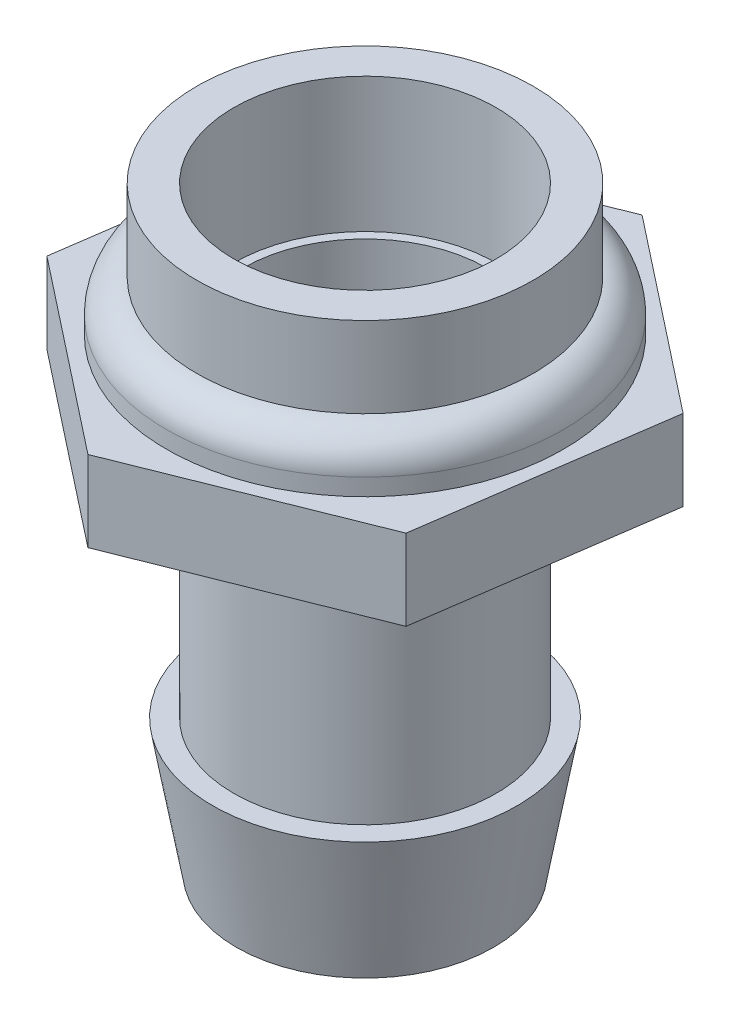
from build123d import *

# Parameters (mm, degrees)
BOSS_EXTRUDE1_DEPTH = 3.048
SKETCH2_R           = 7.493
BOSS_EXTRUDE2_DEPTH = 1.905
SKETCH3_R           = 6.35
BOSS_EXTRUDE3_DEPTH = 3.048
SKETCH5_R           = 4.953
BOSS_EXTRUDE4_DEPTH = 9.4742
SKETCH6_R           = 5.7531
BOSS_EXTRUDE5_DEPTH = 5.08
BOSS_EXTRUDE5_TAPER = 10
FILLET3_R           = 1.27
SKETCH9_R           = 4.6101
CUT_EXTRUDE2_DEPTH  = 56.100911289
SKETCH10_R          = 4.953
CUT_EXTRUDE3_DEPTH  = 5.08


with BuildPart() as part:
    # Sketch1 → Boss-Extrude1 (new body)
    with BuildSketch(Plane(origin=(0, 0, 0), x_dir=(1, 0, 0), z_dir=(0, 1, 0))):
        Polygon((-30.753854436, 4.024561232), (-29.437584499, 13.169073327), (-36.69882931, 18.881252578), (-45.276344058, 15.448919735), (-46.592613995, 6.30440764), (-39.331369184, 0.592228389), align=None)
    extrude(amount=BOSS_EXTRUDE1_DEPTH)

    # Sketch2 → Boss-Extrude2 (add)
    with BuildSketch(Plane(origin=(0, 3.048, 0), x_dir=(1, 0, 0), z_dir=(0, 1, 0))):
        with Locations(Location((-38.015099247, 9.736740484, 0), (0, 0, 90))):
            Circle(SKETCH2_R)
    extrude(amount=BOSS_EXTRUDE2_DEPTH)

    # Sketch3 → Boss-Extrude3 (add)
    with BuildSketch(Plane(origin=(0, 4.953, 0), x_dir=(1, 0, 0), z_dir=(0, 1, 0))):
        with Locations(Location((-38.015099247, 9.736740484, 0), (0, 0, 90))):
            Circle(SKETCH3_R)
    extrude(amount=BOSS_EXTRUDE3_DEPTH)

    # Sketch5 → Boss-Extrude4 (add)
    with BuildSketch(Plane.XZ):
        with Locations(Location((-38.015099247, -9.736740484, 0), (0, 0, 90))):
            Circle(SKETCH5_R)
    extrude(amount=BOSS_EXTRUDE4_DEPTH)

    # Sketch6 → Boss-Extrude5 (add)
    with BuildSketch(Plane.XZ.offset(9.4742)):
        with Locations((-38.015099247, -9.736740484)):
            Circle(SKETCH6_R)
    extrude(amount=BOSS_EXTRUDE5_DEPTH, taper=BOSS_EXTRUDE5_TAPER)

    # Fillet3
    # the kernel refuses this fillet: 1.27 mm, written as the material it takes off along each edge
    with BuildSketch(Plane(origin=(-38.015099247, 4.953, -9.736740484), x_dir=(0, 0, -1), z_dir=(1, 0, 0))) as fillet3_piece_1:
        with BuildLine():
            CenterArc((6.223, -1.263634045), FILLET3_R, 0, 84.260829523)
            Line((6.35, 0), (6.35254, 0.025272681))
            ThreePointArc((6.35254, 0.025272681), (6.9215, 0.0254), (7.493, 0.0254))
            Line((7.493, 0.0254), (7.5184, 0))
            Line((7.5184, 0), (7.5184, -1.263634045))
            Line((7.5184, -1.263634045), (7.493, -1.263634045))
        make_face()
    revolve(axis=Axis((-38.015099247, 4.953, -9.736740484), (0, 1, 0)), mode=Mode.SUBTRACT)

    # Sketch9 → Cut-Extrude2 (cut, through all)
    with BuildSketch(Plane.XZ.offset(14.5542)):
        with Locations(Location((-38.015099247, -9.736740484, 0), (0, 0, 270))):
            Circle(SKETCH9_R)
    extrude(amount=-CUT_EXTRUDE2_DEPTH, mode=Mode.SUBTRACT)

    # Sketch10 → Cut-Extrude3 (cut)
    with BuildSketch(Plane(origin=(0, 8.001, 0), x_dir=(1, 0, 0), z_dir=(0, 1, 0))):
        with Locations(Location((-38.015099247, 9.736740484, 0), (0, 0, 270))):
            Circle(SKETCH10_R)
    extrude(amount=-CUT_EXTRUDE3_DEPTH, mode=Mode.SUBTRACT)


solid = part.part
